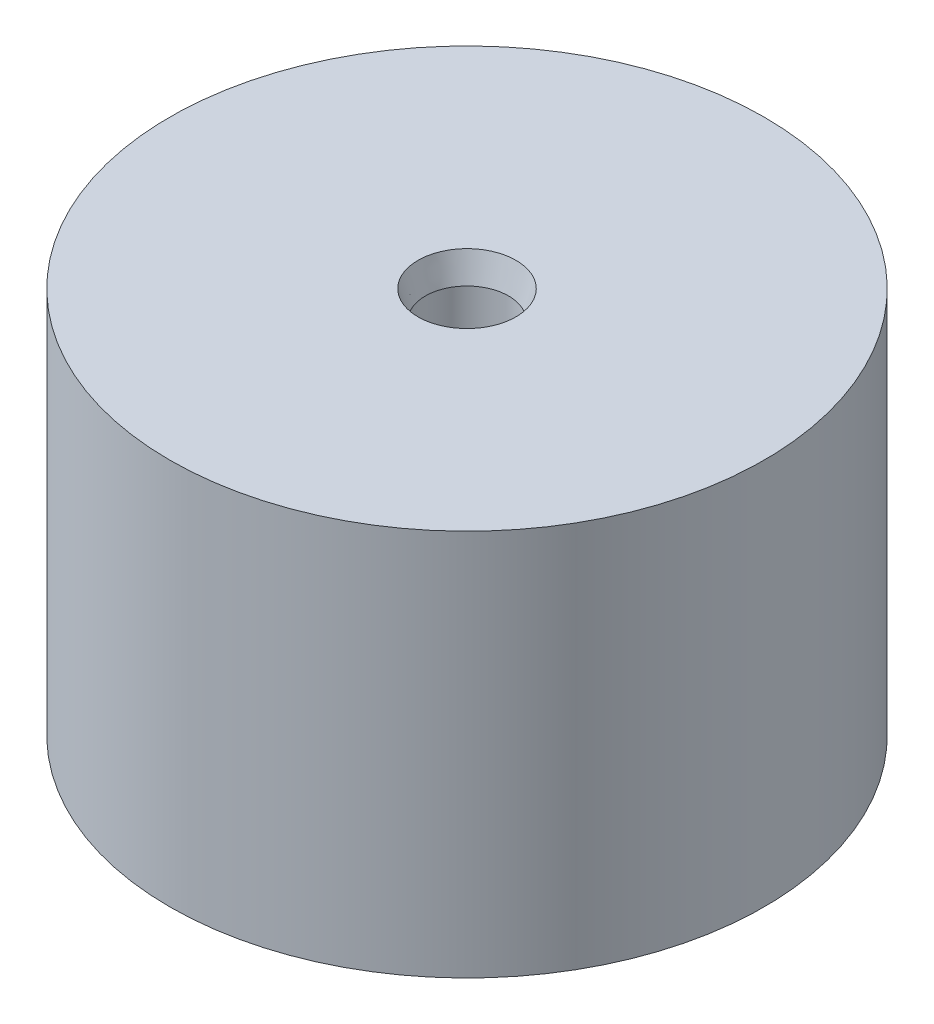
from build123d import *


with BuildPart() as part:
    # Sketch1 → Revolve1 (revolve)
    with BuildSketch(Plane.XY):
        Polygon((-2, 2.5), (-2, -2.5), (-14.25, -14.75), (-14.25, 3.806217783), (-2.35, 3.806217783), align=None)
    revolve(axis=Axis((0, 20.798274686, 0), (0, -1, 0)))


solid = part.part
